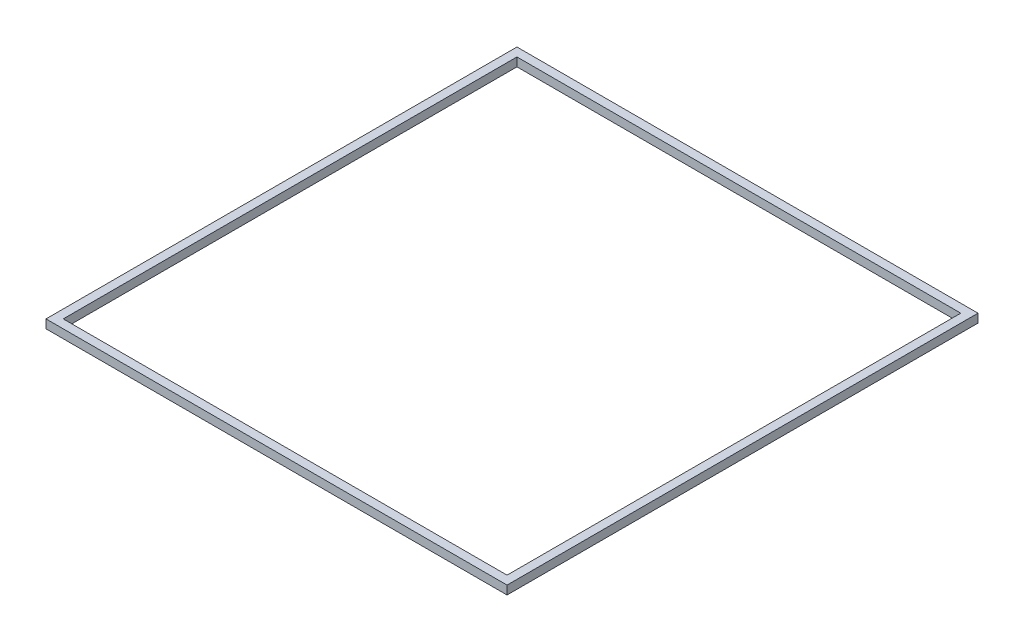
from build123d import *

# Parameters (mm, degrees)
SKETCH1_W           = 85
SKETCH1_H           = 86.825
SKETCH1_W_2         = 81.825
SKETCH1_H_2         = 83.65
BOSS_EXTRUDE1_DEPTH = 1.5875


with BuildPart() as part:
    # Sketch1 → Boss-Extrude1 (new body)
    with BuildSketch(Plane(origin=(0, 0, 0), x_dir=(1, 0, 0), z_dir=(0, 1, 0))):
        with Locations((42.5, 43.4125)):
            Rectangle(SKETCH1_W, SKETCH1_H)
        with Locations((42.5, 43.4125)):
            Rectangle(SKETCH1_W_2, SKETCH1_H_2, mode=Mode.SUBTRACT)
    extrude(amount=BOSS_EXTRUDE1_DEPTH)


solid = part.part
